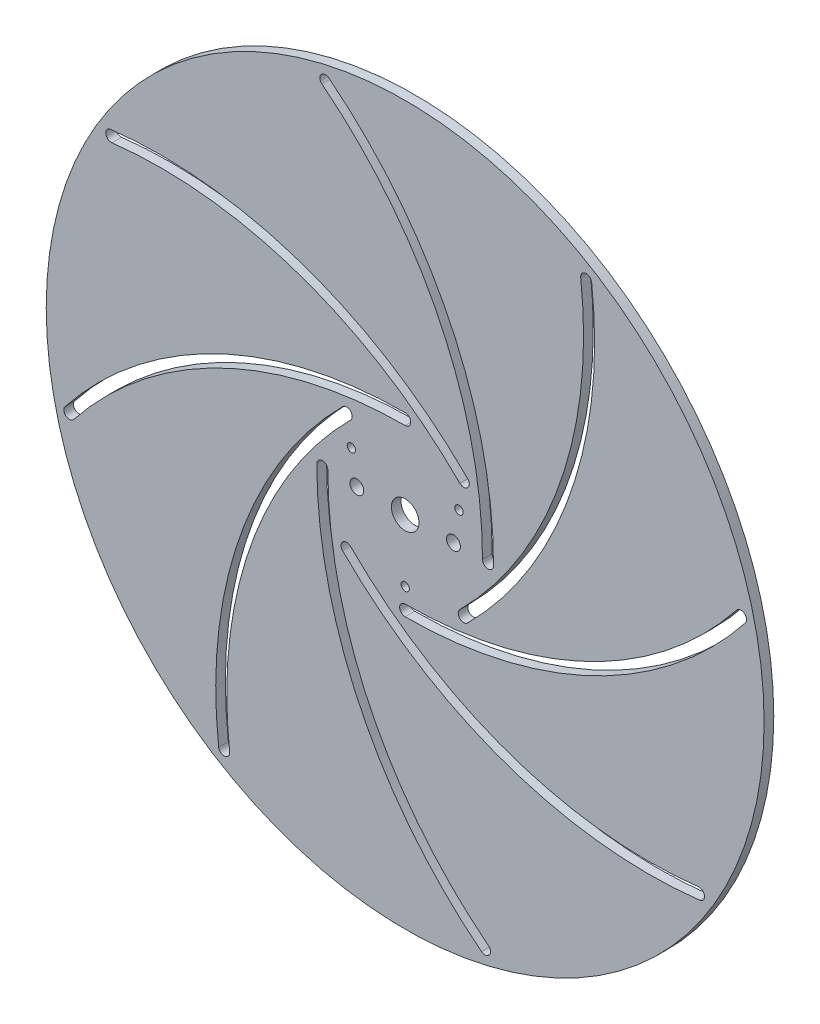
from build123d import *

# Parameters (mm, degrees)
BOSS_EXTRUDE1_DEPTH      = 1.75
BOSS_EXTRUDE1_DEPTH_BACK = 1.75
SKETCH1_R                = 130
SKETCH1_R_2              = 1.5
SKETCH1_R_3              = 2.5


with BuildPart() as part:
    # Sketch1 → Boss-Extrude1 (new, two sides: drawn at the far end of the back side and taken through both)
    with BuildSketch(Plane.XY.offset(-BOSS_EXTRUDE1_DEPTH_BACK)):
        Circle(SKETCH1_R)
        with BuildLine():
            ThreePointArc((-67.544596294, -106.66174343), (-59.916490457, -36.86480939), (-22.627416998, 22.627416998))
            ThreePointArc((-22.627416998, 22.627416998), (-19.798989873, 22.627416998), (-19.798989873, 19.798989873))
            ThreePointArc((-19.798989873, 19.798989873), (-56.138023244, -38.177511002), (-63.571782436, -106.196179206))
            ThreePointArc((-63.571782436, -106.196179206), (-65.325407253, -108.415368247), (-67.544596294, -106.66174343))
        make_face(mode=Mode.SUBTRACT)
        with BuildLine():
            ThreePointArc((27.66, -123.182484144), (-16.3, -68.434713414), (-32, 0))
            ThreePointArc((-32, 0), (-30, 2), (-28, 0))
            ThreePointArc((-28, 0), (-12.7, -66.691153836), (30.14, -120.044076905))
            ThreePointArc((30.14, -120.044076905), (30.46920362, -122.853280525), (27.66, -123.182484144))
        make_face(mode=Mode.SUBTRACT)
        with BuildLine():
            ThreePointArc((106.66174343, -67.544596294), (36.86480939, -59.916490457), (-22.627416998, -22.627416998))
            ThreePointArc((-22.627416998, -22.627416998), (-22.627416998, -19.798989873), (-19.798989873, -19.798989873))
            ThreePointArc((-19.798989873, -19.798989873), (38.177511002, -56.138023244), (106.196179206, -63.571782436))
            ThreePointArc((106.196179206, -63.571782436), (108.415368247, -65.325407253), (106.66174343, -67.544596294))
        make_face(mode=Mode.SUBTRACT)
        with Locations((0, -22.5)):
            Circle(SKETCH1_R_2, mode=Mode.SUBTRACT)
        with Locations((17.5, 0)):
            Circle(SKETCH1_R_3, mode=Mode.SUBTRACT)
        with BuildLine():
            ThreePointArc((123.182484144, 27.66), (68.434713414, -16.3), (0, -32))
            ThreePointArc((0, -32), (-2, -30), (0, -28))
            ThreePointArc((0, -28), (66.691153836, -12.7), (120.044076905, 30.14))
            ThreePointArc((120.044076905, 30.14), (122.853280525, 30.46920362), (123.182484144, 27.66))
        make_face(mode=Mode.SUBTRACT)
        with BuildLine():
            ThreePointArc((-123.182484144, -27.66), (-68.434713414, 16.3), (0, 32))
            ThreePointArc((0, 32), (2, 30), (0, 28))
            ThreePointArc((0, 28), (-66.691153836, 12.7), (-120.044076905, -30.14))
            ThreePointArc((-120.044076905, -30.14), (-122.853280525, -30.46920362), (-123.182484144, -27.66))
        make_face(mode=Mode.SUBTRACT)
        with Locations((-17.5, 0)):
            Circle(SKETCH1_R_3, mode=Mode.SUBTRACT)
        with Locations((-19.485571585, 11.25)):
            Circle(SKETCH1_R_2, mode=Mode.SUBTRACT)
        with BuildLine():
            ThreePointArc((-106.66174343, 67.544596294), (-36.86480939, 59.916490457), (22.627416998, 22.627416998))
            ThreePointArc((22.627416998, 22.627416998), (22.627416998, 19.798989873), (19.798989873, 19.798989873))
            ThreePointArc((19.798989873, 19.798989873), (-38.177511002, 56.138023244), (-106.196179206, 63.571782436))
            ThreePointArc((-106.196179206, 63.571782436), (-108.415368247, 65.325407253), (-106.66174343, 67.544596294))
        make_face(mode=Mode.SUBTRACT)
        with BuildLine():
            ThreePointArc((0.555555556, 4.96903995), (3.726779962, 3.333333333), (5, 0))
            ThreePointArc((5, 0), (-3.354101966, -3.708099244), (-0.5, 4.974937186))
            ThreePointArc((-0.5, 4.974937186), (0.027933838, 4.999921969), (0.555555556, 4.96903995))
        make_face(mode=Mode.SUBTRACT)
        with Locations((19.485571585, 11.25)):
            Circle(SKETCH1_R_2, mode=Mode.SUBTRACT)
        with BuildLine():
            ThreePointArc((-27.66, 123.182484144), (16.3, 68.434713414), (32, 0))
            ThreePointArc((32, 0), (30, -2), (28, 0))
            ThreePointArc((28, 0), (12.7, 66.691153836), (-30.14, 120.044076905))
            ThreePointArc((-30.14, 120.044076905), (-30.46920362, 122.853280525), (-27.66, 123.182484144))
        make_face(mode=Mode.SUBTRACT)
        with BuildLine():
            ThreePointArc((67.544596294, 106.66174343), (59.916490457, 36.86480939), (22.627416998, -22.627416998))
            ThreePointArc((22.627416998, -22.627416998), (19.798989873, -22.627416998), (19.798989873, -19.798989873))
            ThreePointArc((19.798989873, -19.798989873), (56.138023244, 38.177511002), (63.571782436, 106.196179206))
            ThreePointArc((63.571782436, 106.196179206), (65.325407253, 108.415368247), (67.544596294, 106.66174343))
        make_face(mode=Mode.SUBTRACT)
    extrude(amount=BOSS_EXTRUDE1_DEPTH + BOSS_EXTRUDE1_DEPTH_BACK)


solid = part.part
